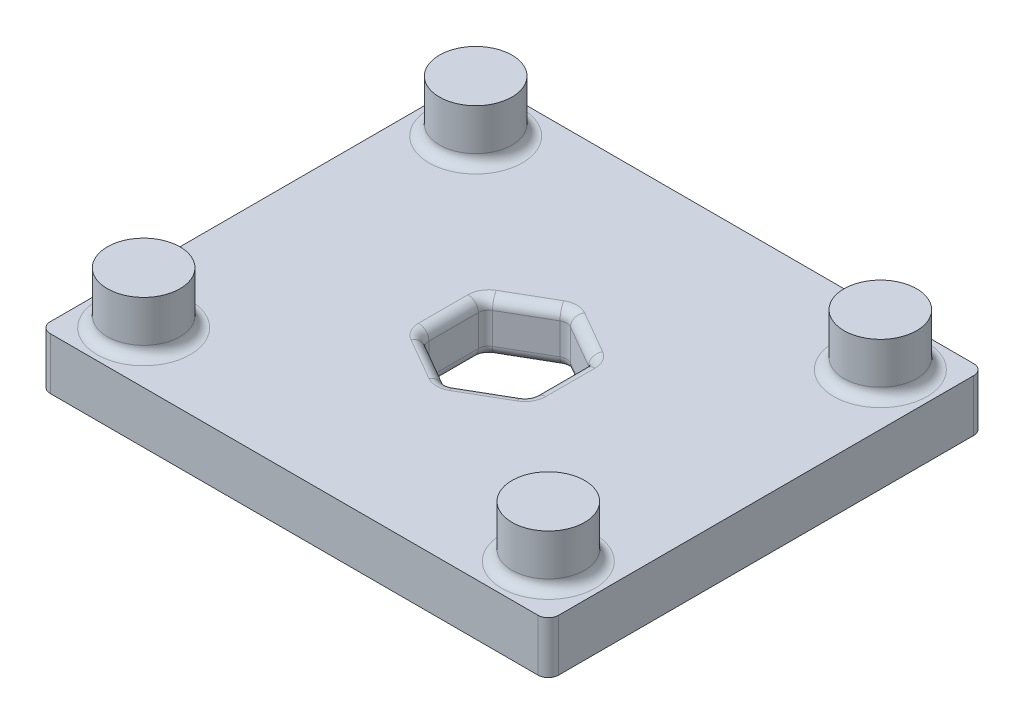
from build123d import *

# Parameters (mm, degrees)
SKETCH2_W           = 49
SKETCH2_H           = 42
BOSS_EXTRUDE1_DEPTH = 5
SKETCH2_3_R         = 3.5
BOSS_EXTRUDE2_DEPTH = 10
FILLET1_R           = 1
FILLET2_R           = 1
FILLET3_R           = 1


with BuildPart() as part:
    # Sketch2 → Boss-Extrude1 (new body)
    with BuildSketch(Plane(origin=(0, 0, 0), x_dir=(1, 0, 0), z_dir=(0, 1, 0))):
        Rectangle(SKETCH2_W, SKETCH2_H)
        Polygon((-5.625, -2.95892013), (-5.625, 2.95892013), (-0.5, 5.917840259), (4.625, 2.95892013), (4.625, -2.95892013), (-0.5, -5.917840259), align=None, mode=Mode.SUBTRACT)
    extrude(amount=BOSS_EXTRUDE1_DEPTH)

    # Sketch2<3> → Boss-Extrude2 (add)
    with BuildSketch(Plane(origin=(0, 0, 0), x_dir=(1, 0, 0), z_dir=(0, 1, 0))):
        with Locations((19.5, -16)):
            Circle(SKETCH2_3_R)
        with Locations((19.5, 16)):
            Circle(SKETCH2_3_R)
        with Locations((-19.5, 16)):
            Circle(SKETCH2_3_R)
        with Locations((-19.5, -16)):
            Circle(SKETCH2_3_R)
    extrude(amount=BOSS_EXTRUDE2_DEPTH)

    # Fillet1
    fillet1_edges = [part.edges().sort_by_distance(p)[0] for p in [
        (-23, 5, -16),
        (16, 5, -16),
        (16, 5, 16),
        (-23, 5, 16),
    ]]
    fillet(fillet1_edges, radius=FILLET1_R)

    # Fillet2
    fillet2_edges = [part.edges().sort_by_distance(p)[0] for p in [
        (4.625, 2.5, -2.95892013),
        (4.625, 2.5, 2.95892013),
        (-24.5, 2.5, -21),
        (24.5, 2.5, -21),
        (24.5, 2.5, 21),
        (-24.5, 2.5, 21),
        (-0.5, 2.5, -5.917840259),
        (-5.625, 2.5, -2.95892013),
        (-5.625, 2.5, 2.95892013),
        (-0.5, 2.5, 5.917840259),
    ]]
    fillet(fillet2_edges, radius=FILLET2_R)

    # Fillet3
    fillet3_edges = [part.edges().sort_by_distance(p)[0] for p in [
        (2.0625, 0, -4.438380194),
        (4.491025404, 0, -2.88156986),
        (4.625, 0, 0),
        (4.491025404, 5, 2.88156986),
        (4.491025404, 0, 2.88156986),
        (4.491025404, 5, -2.88156986),
        (2.0625, 5, -4.438380194),
        (2.0625, 5, 4.438380194),
        (4.625, 5, 0),
        (2.0625, 0, 4.438380194),
        (-0.5, 5, 5.763139721),
        (-3.0625, 5, 4.438380194),
        (-5.491025404, 5, 2.88156986),
        (-5.625, 5, 0),
        (-5.491025404, 5, -2.88156986),
        (-3.0625, 5, -4.438380194),
        (-0.5, 5, -5.763139721),
        (-0.5, 0, 5.763139721),
        (-3.0625, 0, 4.438380194),
        (-5.491025404, 0, 2.88156986),
        (-5.625, 0, 0),
        (-5.491025404, 0, -2.88156986),
        (-3.0625, 0, -4.438380194),
        (-0.5, 0, -5.763139721),
    ]]
    fillet(fillet3_edges, radius=FILLET3_R)


solid = part.part
